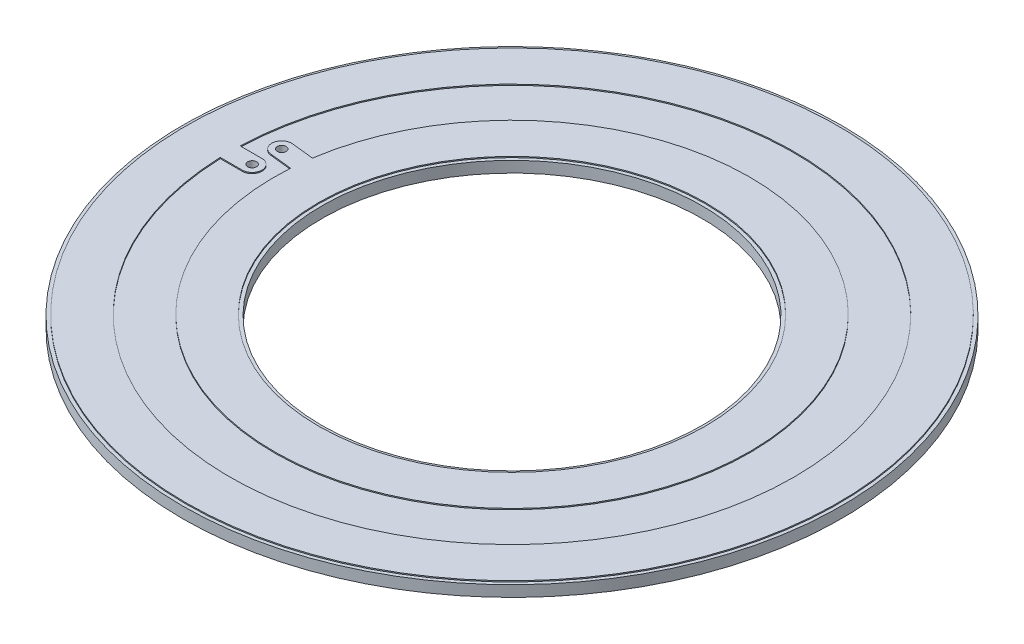
from build123d import *

# Parameters (mm, degrees)
SKETCH_1_R          = 29.8
SKETCH_1_R_2        = 17.2
EXTRUDE_1_DEPTH     = 1
SKETCH_2_R          = 29.5
SKETCH_2_R_2        = 25.5
SKETCH_2_R_3        = 21.5
SKETCH_2_R_4        = 17.5
EXTRUDE_2_DEPTH     = 0.1
SKETCH_4_R          = 0.4
CUT_EXTRUDE_1_DEPTH = 43.155426697
EXTRUDE_START       = 0.1
SKETCH_5_R          = 0.9
SKETCH_5_R_2        = 0.4
EXTRUDE_3_DEPTH     = 0.1
EXTRUDE_4_DEPTH     = 0.1


with BuildPart() as part:
    # Эскиз1 → Бобышка-Вытянуть1 (new body)
    with BuildSketch(Plane(origin=(0, 0, 0), x_dir=(1, 0, 0), z_dir=(0, 1, 0))):
        Circle(SKETCH_1_R)
        Circle(SKETCH_1_R_2, mode=Mode.SUBTRACT)
    extrude(amount=EXTRUDE_1_DEPTH)

    # Эскиз2 → Бобышка-Вытянуть2 (add)
    # profile 1 of 2: a face of its own
    with BuildSketch(Plane(origin=(0, 1, 0), x_dir=(1, 0, 0), z_dir=(0, 1, 0))):
        Circle(SKETCH_2_R)
        Circle(SKETCH_2_R_2, mode=Mode.SUBTRACT)
    # profile 2 of 2: a face of its own
    with BuildSketch(Plane(origin=(0, 1, 0), x_dir=(1, 0, 0), z_dir=(0, 1, 0))):
        Circle(SKETCH_2_R_3)
        Circle(SKETCH_2_R_4, mode=Mode.SUBTRACT)
    extrude(amount=EXTRUDE_2_DEPTH)

    # Эскиз4 → Вырез-Вытянуть1 (cut, through all)
    with BuildSketch(Plane(origin=(0, 1, 0), x_dir=(1, 0, 0), z_dir=(0, 1, 0))):
        with Locations((-23.5, 0)):
            Circle(SKETCH_4_R)
        with Locations((-23.362328651, 2.54)):
            Circle(SKETCH_4_R)
    extrude(amount=-CUT_EXTRUDE_1_DEPTH, mode=Mode.SUBTRACT)

    # Эскиз5 → Бобышка-Вытянуть3 (add)
    # profile 1 of 2: a face of its own
    with BuildSketch(Plane(origin=(0, 1, 0), x_dir=(1, 0, 0), z_dir=(0, 1, 0)).offset(EXTRUDE_START)):
        with Locations((-23.362328651, 2.54)):
            Circle(SKETCH_5_R)
        with Locations((-23.362328651, 2.54)):
            Circle(SKETCH_5_R_2, mode=Mode.SUBTRACT)
    # profile 2 of 2: a face of its own
    with BuildSketch(Plane(origin=(0, 1, 0), x_dir=(1, 0, 0), z_dir=(0, 1, 0)).offset(EXTRUDE_START)):
        with Locations((-23.5, 0)):
            Circle(SKETCH_5_R)
        with Locations((-23.5, 0)):
            Circle(SKETCH_5_R_2, mode=Mode.SUBTRACT)
    extrude(amount=-EXTRUDE_3_DEPTH)

    # Эскиз6 → Бобышка-Вытянуть4 (add)
    with BuildSketch(Plane(origin=(0, 1, 0), x_dir=(1, 0, 0), z_dir=(0, 1, 0))):
        Polygon((-23.5, -0.9), (-27.456522895, -0.9), (-27.456522895, 0.9), (-23.5, 0.9), (-24.110773747, 0), align=None)
        Polygon((-23.362328651, 1.64), (-20.018109834, 1.276409712), (-19.824696405, 3.05538141), (-23.168915221, 3.418971698), (-22.768010698, 2.47538454), align=None)
    extrude(amount=EXTRUDE_4_DEPTH)


solid = part.part
